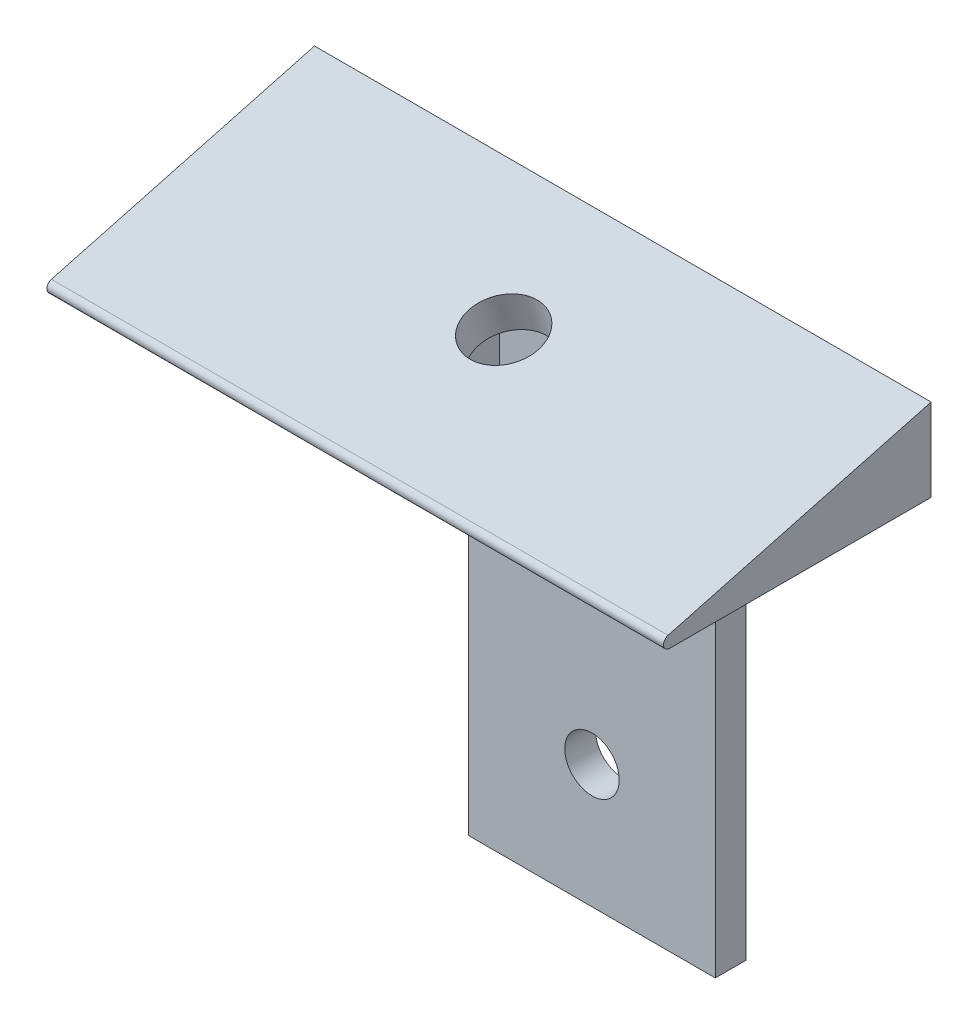
from build123d import *

# Parameters (mm, degrees)
SKETCH1_W                       = 25.4
SKETCH1_H                       = 50.8
BOSS_EXTRUDE1_DEPTH             = 3.175
F_10_CLEARANCE_HOLE1_D          = 5.6134
BOSS_EXTRUDE3_DEPTH             = 31.75
CHAMFER2_SIZE                   = 12.7
FILLET2_R                       = 0.635
BOSS_EXTRUDE4_REACH             = 64.331
BOSS_EXTRUDE4_DIRECTION_2_DEPTH = 3.175
BOSS_EXTRUDE5_REACH             = 64.331
BOSS_EXTRUDE5_DIRECTION_2_DEPTH = 3.175
F_1_4_CLEARANCE_HOLE2_REACH     = 70.01
F_1_4_CLEARANCE_HOLE2_BORE_R    = 3.57124
CUT_EXTRUDE1_START              = -9.525
CUT_EXTRUDE1_DEPTH              = 19.05


# Read off the part's stored shape, not the designer's step: Cut-Extrude1
with BuildPart() as part:
    # Sketch1 → Boss-Extrude1 (new body)
    with BuildSketch(Plane.XY):
        Rectangle(SKETCH1_W, SKETCH1_H)
    extrude(amount=BOSS_EXTRUDE1_DEPTH)

    # #10 Clearance Hole1 (through all)
    with Locations(Plane(origin=(0, 0, 0), x_dir=(-1, 0, 0), z_dir=(0, 0, -1))):
        with Locations((0, 12.7), (0, -12.7)):
            Hole(F_10_CLEARANCE_HOLE1_D / 2)

    # Sketch8 → Boss-Extrude3 (add, symmetric)
    with BuildSketch(Plane(origin=(0, 0, 0), x_dir=(0, 0, -1), z_dir=(1, 0, 0))):
        Polygon((0, 33.90738686), (-31.75, 25.4), (0, 25.4), align=None)
    extrude(amount=BOSS_EXTRUDE3_DEPTH, both=True)

    # Chamfer2
    chamfer2_edges = [part.edges().sort_by_distance(p)[0] for p in [
        (-12.7, 25.4, 1.5875),
        (12.7, 25.4, 1.5875),
    ]]
    chamfer(chamfer2_edges, length=CHAMFER2_SIZE)

    # Fillet2
    fillet2_edges = [part.edges().sort_by_distance(p)[0] for p in [
        (0, 25.4, 31.75),
    ]]
    fillet(fillet2_edges, radius=FILLET2_R)

    # Boss-Extrude4: up to this face of the body (flat: up to its plane)
    boss_extrude4_end = Plane(part.part.faces().sort_by_distance((-19.05, 19.05, 1.5875))[0])
    # Sketch14 → Boss-Extrude4 (add, up to the picked face)
    with BuildSketch(Plane.ZY.offset(12.7), mode=Mode.PRIVATE) as boss_extrude4_sk1:
        Polygon((3.175, 12.7), (15.875, 25.4), (3.175, 25.4), align=None)
    boss_extrude4_tool1 = split(extrude(boss_extrude4_sk1.sketch, amount=BOSS_EXTRUDE4_REACH, mode=Mode.PRIVATE), bisect_by=boss_extrude4_end, keep=Keep.BOTH, mode=Mode.PRIVATE)
    add(boss_extrude4_tool1.solids().sort_by(Axis((-12.7, 21.166667, 7.408333), (-1, 0, 0)))[0])

    # Sketch14 → Boss-Extrude4 direction 2 (add)
    with BuildSketch(Plane.ZY.offset(12.7)):
        Polygon((3.175, 12.7), (15.875, 25.4), (3.175, 25.4), align=None)
    extrude(amount=-BOSS_EXTRUDE4_DIRECTION_2_DEPTH)

    # Boss-Extrude5: up to this face of the body (flat: up to its plane)
    boss_extrude5_end = Plane(part.part.faces().sort_by_distance((19.05, 19.05, 1.5875))[0])
    # Sketch15 → Boss-Extrude5 (add, up to the picked face)
    with BuildSketch(Plane(origin=(12.7, 0, 0), x_dir=(0, 0, -1), z_dir=(1, 0, 0)), mode=Mode.PRIVATE) as boss_extrude5_sk1:
        Polygon((-3.175, 12.7), (-15.875, 25.4), (-3.175, 25.4), align=None)
    boss_extrude5_tool1 = split(extrude(boss_extrude5_sk1.sketch, amount=BOSS_EXTRUDE5_REACH, mode=Mode.PRIVATE), bisect_by=boss_extrude5_end, keep=Keep.BOTH, mode=Mode.PRIVATE)
    add(boss_extrude5_tool1.solids().sort_by(Axis((12.7, 21.166667, 7.408333), (1, 0, 0)))[0])

    # Sketch15 → Boss-Extrude5 direction 2 (add)
    with BuildSketch(Plane(origin=(12.7, 0, 0), x_dir=(0, 0, -1), z_dir=(1, 0, 0))):
        Polygon((-3.175, 12.7), (-15.875, 25.4), (-3.175, 25.4), align=None)
    extrude(amount=-BOSS_EXTRUDE5_DIRECTION_2_DEPTH)

    # 1/4 Clearance Hole2 bore → 1/4 Clearance Hole2 (cut, up to next)
    with BuildSketch(Plane(origin=(0, 31.636022628, 8.476846715), x_dir=(1, 0, 0), z_dir=(0, 0.96592582628907, 0.2588190451025146)), mode=Mode.PRIVATE) as f_1_4_clearance_hole2_sk1:
        with Locations((0, -3.924122511)):
            Circle(F_1_4_CLEARANCE_HOLE2_BORE_R)
    f_1_4_clearance_hole2_tool1 = extrude(f_1_4_clearance_hole2_sk1.sketch, amount=-F_1_4_CLEARANCE_HOLE2_REACH, mode=Mode.PRIVATE) & part.part
    add(f_1_4_clearance_hole2_tool1.solids().sort_by_distance((0, 30.620385, 12.267258))[0], mode=Mode.SUBTRACT)

    # Cut-Extrude1 outline → Cut-Extrude1 (cut)
    with BuildSketch(Plane.YZ.offset(CUT_EXTRUDE1_START)):
        Polygon((29.112245926, 3.175), (25.4, 17.029290407), (25.4, 3.175), align=None)
    extrude(amount=CUT_EXTRUDE1_DEPTH, mode=Mode.SUBTRACT)


solid = part.part
